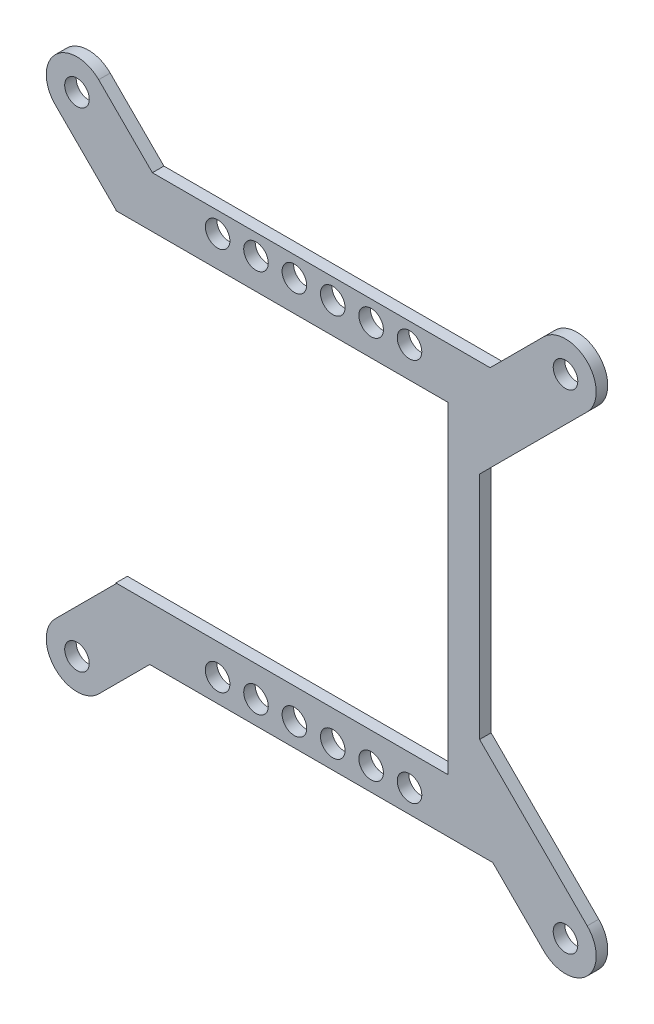
from build123d import *

# Parameters (mm, degrees)
CUT_EXTRUDE1_START       = -1.5
CUT_EXTRUDE1_OUTLINE_R   = 1.6
CUT_EXTRUDE1_DEPTH       = 1.5
CUT_EXTRUDE1_2_OUTLINE_R = 1.6
CUT_EXTRUDE1_2_DEPTH     = 1.5
CUT_EXTRUDE1_3_OUTLINE_R = 1.6
CUT_EXTRUDE1_3_DEPTH     = 1.5
BOSS_EXTRUDE1_DEPTH      = 1.5
BOSS_EXTRUDE2_DEPTH      = 1.5
BOSS_EXTRUDE3_START      = -1.5
SKETCH4_W                = 8
SKETCH4_H                = 34
SKETCH4_R                = 1.6
BOSS_EXTRUDE3_DEPTH      = 1.5
CUT_EXTRUDE2_DEPTH       = 10
SKETCH6_R                = 1.6
CUT_EXTRUDE3_DEPTH       = 10
CUT_EXTRUDE4_DEPTH       = 10
SKETCH8_R                = 1.6
CUT_EXTRUDE6_DEPTH       = 10
BOSS_EXTRUDE4_DEPTH      = 1.5
SKETCH10_W               = 3.5
SKETCH10_H               = 42
CUT_EXTRUDE7_DEPTH       = 10
CUT_EXTRUDE8_START       = -10
SKETCH11_R               = 1.6
CUT_EXTRUDE8_DEPTH       = 10
BOSS_EXTRUDE5_DEPTH      = 1.5
SKETCH13_R               = 1.6
BOSS_EXTRUDE6_DEPTH      = 1.5
SKETCH14_R               = 1.6
CUT_EXTRUDE9_DEPTH       = 10
BOSS_EXTRUDE7_DEPTH      = 1.5
SKETCH16_R               = 1.6
CUT_EXTRUDE10_DEPTH      = 10
SKETCH17_R               = 1.6
BOSS_EXTRUDE8_DEPTH      = 1.5
SKETCH18_R               = 1.6
CUT_EXTRUDE11_DEPTH      = 10
CUT_EXTRUDE12_START      = -2
CUT_EXTRUDE12_OUTLINE_R  = 1.6
CUT_EXTRUDE12_DEPTH      = 3
SKETCH20_R               = 1.6
BOSS_EXTRUDE9_DEPTH      = 1.5
SKETCH21_R               = 1.6
BOSS_EXTRUDE10_DEPTH     = 1.5
SKETCH22_R               = 89.618816207
CUT_EXTRUDE13_DEPTH      = 10


with BuildPart() as part:
    # Cut-Extrude1: read off the stored shape, not the designer's step
    # Cut-Extrude1 outline → Cut-Extrude1 (new body)
    with BuildSketch(Plane.XY.offset(1.5).offset(CUT_EXTRUDE1_START)):
        with BuildLine():
            ThreePointArc((-32.828427125, -27.171572875), (-32.828427125, -32.828427125), (-27.171572875, -32.828427125))
            Line((-27.171572875, -32.828427125), (-15.343145751, -21))
            Line((-15.343145751, -21), (-28, -21))
            Line((-28, -21), (-28, -22.246575342))
            Line((-28, -22.246575342), (-32.876712329, -27.123287671))
            Line((-32.876712329, -27.123287671), (-32.828427125, -27.171572875))
        make_face()
        with Locations((-30, -30)):
            Circle(CUT_EXTRUDE1_OUTLINE_R, mode=Mode.SUBTRACT)
    extrude(amount=CUT_EXTRUDE1_DEPTH)



with BuildPart() as body_2:
    # Cut-Extrude1 2 outline → Cut-Extrude1 2 (new body)
    with BuildSketch(Plane.XY.offset(1.5).offset(CUT_EXTRUDE1_START)):
        with BuildLine():
            Line((21, 31.740068927), (21, -13))
            Line((21, -13), (13, -13))
            Line((13, -13), (13, -20))
            Line((13, -20), (14.343145751, -20))
            Line((14.343145751, -20), (27.171572875, -32.828427125))
            ThreePointArc((27.171572875, -32.828427125), (32.828427125, -32.828427125), (32.828427125, -27.171572875))
            Line((32.828427125, -27.171572875), (28, -22.343145751))
            Line((28, -22.343145751), (28, 27.653870467))
            Line((28, 27.653870467), (36.085493114, 37.454468181))
            ThreePointArc((36.085493114, 37.454468181), (35.545531819, 43.085493114), (29.914506886, 42.545531819))
            Line((29.914506886, 42.545531819), (21, 31.740068927))
        make_face()
        with Locations((30, -30)):
            Circle(CUT_EXTRUDE1_2_OUTLINE_R, mode=Mode.SUBTRACT)
        with Locations((25, -6.5)):
            Circle(CUT_EXTRUDE1_2_OUTLINE_R, mode=Mode.SUBTRACT)
        with Locations((25, -1.5)):
            Circle(CUT_EXTRUDE1_2_OUTLINE_R, mode=Mode.SUBTRACT)
        with Locations((25, 3.5)):
            Circle(CUT_EXTRUDE1_2_OUTLINE_R, mode=Mode.SUBTRACT)
        with Locations((25, 8.5)):
            Circle(CUT_EXTRUDE1_2_OUTLINE_R, mode=Mode.SUBTRACT)
        with Locations((25, 13.5)):
            Circle(CUT_EXTRUDE1_2_OUTLINE_R, mode=Mode.SUBTRACT)
        with Locations((33, 40)):
            Circle(CUT_EXTRUDE1_2_OUTLINE_R, mode=Mode.SUBTRACT)
    extrude(amount=CUT_EXTRUDE1_2_DEPTH)



with BuildPart() as body_3:
    # Cut-Extrude1 3 outline → Cut-Extrude1 3 (new body)
    with BuildSketch(Plane.XY.offset(1.5).offset(CUT_EXTRUDE1_START)):
        with BuildLine():
            Line((-28, 21), (-21, 21))
            Line((-21, 21), (-21, 31.740068927))
            Line((-21, 31.740068927), (-29.914506886, 42.545531819))
            ThreePointArc((-29.914506886, 42.545531819), (-35.545531819, 43.085493114), (-36.085493114, 37.454468181))
            Line((-36.085493114, 37.454468181), (-28, 27.653870467))
            Line((-28, 27.653870467), (-28, 21))
        make_face()
        with Locations((-33, 40)):
            Circle(CUT_EXTRUDE1_3_OUTLINE_R, mode=Mode.SUBTRACT)
    extrude(amount=CUT_EXTRUDE1_3_DEPTH)


with BuildPart() as body_2_1:
    add(body_2.part)

    add(body_3.part)  # Boss-Extrude1 merges body 3
    # Sketch2 → Boss-Extrude1 (add)
    with BuildSketch(Plane.XY.offset(1.5)):
        Polygon((-21, 21), (21, 21), (21, 31.740068927), (17.62888627, 27.653870467), (-17.62888627, 27.653870467), (-21, 31.740068927), align=None)
    extrude(amount=-BOSS_EXTRUDE1_DEPTH)


with BuildPart() as part_1:
    add(part.part)

    add(body_2_1.part)  # Boss-Extrude2 merges body 2
    # Sketch3 → Boss-Extrude2 (add)
    with BuildSketch(Plane.XY.offset(1.5)):
        Polygon((-15.343145751, -21), (-22.343145751, -28), (22.343145751, -28), (15.343145751, -21), align=None)
    extrude(amount=-BOSS_EXTRUDE2_DEPTH)

    # Sketch4 → Boss-Extrude3 (add)
    with BuildSketch(Plane.XY.offset(1.5).offset(BOSS_EXTRUDE3_START)):
        Polygon((14.343145751, -20), (13, -20), (13, -21), (15.343145751, -21), align=None)
        with Locations((17, 4)):
            Rectangle(SKETCH4_W, SKETCH4_H)
        with Locations((25, -6.5)):
            Circle(SKETCH4_R)
        with Locations((25, -1.5)):
            Circle(SKETCH4_R)
        with Locations((25, 3.5)):
            Circle(SKETCH4_R)
        with Locations((25, 8.5)):
            Circle(SKETCH4_R)
        with Locations((25, 13.5)):
            Circle(SKETCH4_R)
    extrude(amount=BOSS_EXTRUDE3_DEPTH)

    # Sketch5 → Cut-Extrude2 (cut)
    with BuildSketch(Plane.XY.offset(1.5)):
        Polygon((28, 27.653870467), (17.62888627, 15.082823521), (17.62888627, -11.972032021), (28, -22.343145751), align=None)
    extrude(amount=-CUT_EXTRUDE2_DEPTH, mode=Mode.SUBTRACT)

    # Sketch6 → Cut-Extrude3 (cut)
    with BuildSketch(Plane.XY.offset(1.5)):
        with Locations((6.5, 25)):
            Circle(SKETCH6_R)
        with Locations((1.5, 25)):
            Circle(SKETCH6_R)
        with Locations((-3.5, 25)):
            Circle(SKETCH6_R)
        with Locations((-8.5, 25)):
            Circle(SKETCH6_R)
        with Locations((-13.5, 25)):
            Circle(SKETCH6_R)
        with Locations((-13.5, -25)):
            Circle(SKETCH6_R)
        with Locations((-8.5, -25)):
            Circle(SKETCH6_R)
        with Locations((-3.5, -25)):
            Circle(SKETCH6_R)
        with Locations((1.5, -25)):
            Circle(SKETCH6_R)
        with Locations((6.5, -25)):
            Circle(SKETCH6_R)
    extrude(amount=-CUT_EXTRUDE3_DEPTH, mode=Mode.SUBTRACT)

    # Sketch7 → Cut-Extrude4 (cut)
    with BuildSketch(Plane.XY.offset(1.5)):
        Polygon((-28, 27.653870467), (-19.973613934, 17.924917659), (-36.717571938, 15.874580857), align=None)
        Polygon((-28, -22.246575342), (-20.930672911, -15.177248254), (-29.189636074, -18.711911798), align=None)
    extrude(amount=-CUT_EXTRUDE4_DEPTH, mode=Mode.SUBTRACT)

    # Sketch8 → Cut-Extrude6 (cut)
    with BuildSketch(Plane.XY.offset(1.5)):
        with Locations((11.5, -25)):
            Circle(SKETCH8_R)
        with Locations((11.5, 25)):
            Circle(SKETCH8_R)
    extrude(amount=-CUT_EXTRUDE6_DEPTH, mode=Mode.SUBTRACT)

    # Sketch9 → Boss-Extrude4 (add)
    with BuildSketch(Plane.XY.offset(1.5)):
        Polygon((20.62888627, 1.55539575), (20.62888627, 18.719187158), (17.62888627, 15.082823521), (17.62888627, -11.972032021), (20.62888627, -14.972032021), align=None)
    extrude(amount=-BOSS_EXTRUDE4_DEPTH)

    # Sketch10 → Cut-Extrude7 (cut)
    with BuildSketch(Plane.XY.offset(1.5)):
        with Locations((14.75, 0)):
            Rectangle(SKETCH10_W, SKETCH10_H)
    extrude(amount=-CUT_EXTRUDE7_DEPTH, mode=Mode.SUBTRACT)

    # Sketch11 → Cut-Extrude8 (cut)
    # profile 1 of 4: a face of its own
    with BuildSketch(Plane.XY.offset(1.5).offset(CUT_EXTRUDE8_START)):
        with BuildLine():
            Line((20.62888627, 27.653870467), (20.62888627, 18.719187158))
            Line((20.62888627, 18.719187158), (36.085493114, 37.454468181))
            ThreePointArc((36.085493114, 37.454468181), (35.545531819, 43.085493114), (29.914506886, 42.545531819))
            Line((29.914506886, 42.545531819), (17.62888627, 27.653870467))
            Line((17.62888627, 27.653870467), (20.62888627, 27.653870467))
        make_face()
        with Locations((33, 40)):
            Circle(SKETCH11_R, mode=Mode.SUBTRACT)
    # profile 2 of 4: a face of its own
    with BuildSketch(Plane.XY.offset(1.5).offset(CUT_EXTRUDE8_START)):
        with BuildLine():
            Line((-36.085493114, 37.454468181), (-26.753424658, 26.142870052))
            Line((-26.753424658, 26.142870052), (-26.753424658, 27.653870467))
            Line((-26.753424658, 27.653870467), (-17.62888627, 27.653870467))
            Line((-17.62888627, 27.653870467), (-29.914506886, 42.545531819))
            ThreePointArc((-29.914506886, 42.545531819), (-35.545531819, 43.085493114), (-36.085493114, 37.454468181))
        make_face()
        with Locations((-33, 40)):
            Circle(SKETCH11_R, mode=Mode.SUBTRACT)
    # profile 3 of 4: a face of its own
    with BuildSketch(Plane.XY.offset(1.5).offset(CUT_EXTRUDE8_START)):
        with BuildLine():
            Line((-27.171572875, -32.828427125), (-22.343145751, -28))
            Line((-22.343145751, -28), (-26.753424658, -28))
            Line((-26.753424658, -28), (-26.753424658, -21))
            Line((-26.753424658, -21), (-32.876712329, -27.123287671))
            Line((-32.876712329, -27.123287671), (-32.828427125, -27.171572875))
            ThreePointArc((-32.828427125, -27.171572875), (-32.828427125, -32.828427125), (-27.171572875, -32.828427125))
        make_face()
        with Locations((-30, -30)):
            Circle(SKETCH11_R, mode=Mode.SUBTRACT)
    # profile 4 of 4: a face of its own
    with BuildSketch(Plane.XY.offset(1.5).offset(CUT_EXTRUDE8_START)):
        with BuildLine():
            Line((32.828427125, -27.171572875), (20.62888627, -14.972032021))
            Line((20.62888627, -14.972032021), (20.62888627, -28))
            Line((20.62888627, -28), (22.343145751, -28))
            Line((22.343145751, -28), (27.171572875, -32.828427125))
            ThreePointArc((27.171572875, -32.828427125), (32.828427125, -32.828427125), (32.828427125, -27.171572875))
        make_face()
        with Locations((30, -30)):
            Circle(SKETCH11_R, mode=Mode.SUBTRACT)
    extrude(amount=CUT_EXTRUDE8_DEPTH, mode=Mode.SUBTRACT)

    # Sketch12 → Boss-Extrude5 (add)
    with BuildSketch(Plane.XY.offset(1.5)):
        Polygon((-22.510556865, 21), (-26.753424658, 21), (-26.753424658, 26.142870052), align=None)
    extrude(amount=-BOSS_EXTRUDE5_DEPTH)

    # Sketch13 → Boss-Extrude6 (add)
    # profile 1 of 4: a face of its own
    with BuildSketch(Plane.XY.offset(1.5)):
        with BuildLine():
            Line((20.62888627, 26.28574052), (20.62888627, 14.972032021))
            Line((20.62888627, 14.972032021), (46.669047558, 41.012193309))
            ThreePointArc((46.669047558, 41.012193309), (46.669047558, 46.669047558), (41.012193309, 46.669047558))
            Line((41.012193309, 46.669047558), (20.62888627, 26.28574052))
        make_face()
    # profile 2 of 4: a face of its own
    with BuildSketch(Plane.XY.offset(1.5)):
        with BuildLine():
            Line((-46.669047558, 41.012193309), (-26.753424658, 21.096570408))
            Line((-26.753424658, 21.096570408), (-26.753424658, 27.653870467))
            Line((-26.753424658, 27.653870467), (-21.997016217, 27.653870467))
            Line((-21.997016217, 27.653870467), (-41.012193309, 46.669047558))
            ThreePointArc((-41.012193309, 46.669047558), (-46.669047558, 46.669047558), (-46.669047558, 41.012193309))
        make_face()
        with Locations((-43.840620434, 43.840620434)):
            Circle(SKETCH13_R, mode=Mode.SUBTRACT)
    # profile 3 of 4: a face of its own
    with BuildSketch(Plane.XY.offset(1.5)):
        with BuildLine():
            ThreePointArc((-46.669047558, -41.012193309), (-46.669047558, -46.669047558), (-41.012193309, -46.669047558))
            Line((-41.012193309, -46.669047558), (-22.343145751, -28))
            Line((-22.343145751, -28), (-26.753424658, -28))
            Line((-26.753424658, -28), (-26.753424658, -21.096570408))
            Line((-26.753424658, -21.096570408), (-46.669047558, -41.012193309))
        make_face()
        with Locations((-43.840620434, -43.840620434)):
            Circle(SKETCH13_R, mode=Mode.SUBTRACT)
    # profile 4 of 4: a face of its own
    with BuildSketch(Plane.XY.offset(1.5)):
        with BuildLine():
            Line((20.62888627, -26.28574052), (41.012193309, -46.669047558))
            ThreePointArc((41.012193309, -46.669047558), (46.669047558, -46.669047558), (46.669047558, -41.012193309))
            Line((46.669047558, -41.012193309), (20.62888627, -14.972032021))
            Line((20.62888627, -14.972032021), (20.62888627, -26.28574052))
        make_face()
        with Locations((43.840620434, -43.840620434)):
            Circle(SKETCH13_R, mode=Mode.SUBTRACT)
    extrude(amount=-BOSS_EXTRUDE6_DEPTH)

    # Sketch14 → Cut-Extrude9 (cut)
    with BuildSketch(Plane.XY.offset(1.5)):
        with Locations((43.840620434, 43.840620434)):
            Circle(SKETCH14_R)
    extrude(amount=-CUT_EXTRUDE9_DEPTH, mode=Mode.SUBTRACT)

    # Sketch15 → Boss-Extrude7 (add)
    with BuildSketch(Plane.XY.offset(1.5)):
        Polygon((20.62888627, -28), (22.343145751, -28), (22.343145751, -20.852318202), (17.520154223, -24.044979555), align=None)
        Polygon((20.62888627, 27.653870467), (24.477160925, 27.653870467), (19.074520247, 22.251229789), (17.520154223, 26.392880602), align=None)
    extrude(amount=-BOSS_EXTRUDE7_DEPTH)

    # Sketch16 → Cut-Extrude10 (cut)
    with BuildSketch(Plane.XY.offset(1.5)):
        with Locations((-31.819805153, 31.819805153)):
            Circle(SKETCH16_R)
        with Locations((31.819805153, 31.819805153)):
            Circle(SKETCH16_R)
        with Locations((31.819805153, -31.819805153)):
            Circle(SKETCH16_R)
        with Locations((-31.819805153, -31.819805153)):
            Circle(SKETCH16_R)
    extrude(amount=-CUT_EXTRUDE10_DEPTH, mode=Mode.SUBTRACT)

    # Sketch17 → Boss-Extrude8 (add)
    with BuildSketch(Plane.XY.offset(1.5)):
        with BuildLine():
            ThreePointArc((-31.819805153, 35.819805153), (-28.355703538, 33.819805153), (-28.355703538, 29.819805153))
            Line((-28.355703538, 29.819805153), (28.355703538, 29.819805153))
            ThreePointArc((28.355703538, 29.819805153), (28.355703538, 33.819805153), (31.819805153, 35.819805153))
            Line((31.819805153, 35.819805153), (-31.819805153, 35.819805153))
        make_face()
        with Locations((-8, 32.819805153)):
            Circle(SKETCH17_R, mode=Mode.SUBTRACT)
        with Locations((8, 32.819805153)):
            Circle(SKETCH17_R, mode=Mode.SUBTRACT)
    extrude(amount=-BOSS_EXTRUDE8_DEPTH)

    # Sketch18 → Cut-Extrude11 (cut)
    with BuildSketch(Plane.XY.offset(1.5)):
        with Locations((38.890872965, -38.890872965)):
            Circle(SKETCH18_R)
        with Locations((-38.890872965, -38.890872965)):
            Circle(SKETCH18_R)
        with Locations((38.890872965, 38.890872965)):
            Circle(SKETCH18_R)
        with Locations((-38.890872965, 38.890872965)):
            Circle(SKETCH18_R)
    extrude(amount=-CUT_EXTRUDE11_DEPTH, mode=Mode.SUBTRACT)

    # Cut-Extrude12: read off the stored shape, not the designer's step
    # Cut-Extrude12 outline → Cut-Extrude12 (cut)
    # profile 1 of 4: a face of its own
    with BuildSketch(Plane.XY.offset(1.5).offset(CUT_EXTRUDE12_START)):
        with BuildLine():
            Line((36.222978367, 41.879832617), (36.224492351, 41.872552763))
            ThreePointArc((36.224492351, 41.872552763), (41.797056095, 41.639345199), (41.71930009, 36.062445841))
            Line((41.71930009, 36.062445841), (46.669047558, 41.012193309))
            ThreePointArc((46.669047558, 41.012193309), (46.669047558, 46.669047558), (41.012193309, 46.669047558))
            Line((41.012193309, 46.669047558), (36.222978367, 41.879832617))
        make_face()
        with Locations((43.840620434, 43.840620434)):
            Circle(CUT_EXTRUDE12_OUTLINE_R, mode=Mode.SUBTRACT)
    # profile 2 of 4: a face of its own
    with BuildSketch(Plane.XY.offset(1.5).offset(CUT_EXTRUDE12_START)):
        with BuildLine():
            ThreePointArc((41.71930009, -36.062445841), (41.71930009, -41.71930009), (36.062445841, -41.71930009))
            Line((36.062445841, -41.71930009), (41.012193309, -46.669047558))
            ThreePointArc((41.012193309, -46.669047558), (46.669047558, -46.669047558), (46.669047558, -41.012193309))
            Line((46.669047558, -41.012193309), (41.71930009, -36.062445841))
        make_face()
        with Locations((43.840620434, -43.840620434)):
            Circle(CUT_EXTRUDE12_OUTLINE_R, mode=Mode.SUBTRACT)
    # profile 3 of 4: a face of its own
    with BuildSketch(Plane.XY.offset(1.5).offset(CUT_EXTRUDE12_START)):
        with BuildLine():
            ThreePointArc((-36.062445841, -41.71930009), (-41.550778866, -41.878330178), (-42.027335486, -36.408413931))
            Line((-42.027335486, -36.408413931), (-42.048509384, -36.391655135))
            Line((-42.048509384, -36.391655135), (-46.669047558, -41.012193309))
            ThreePointArc((-46.669047558, -41.012193309), (-46.669047558, -46.669047558), (-41.012193309, -46.669047558))
            Line((-41.012193309, -46.669047558), (-36.062445841, -41.71930009))
        make_face()
        with Locations((-43.840620434, -43.840620434)):
            Circle(CUT_EXTRUDE12_OUTLINE_R, mode=Mode.SUBTRACT)
    # profile 4 of 4: a face of its own
    with BuildSketch(Plane.XY.offset(1.5).offset(CUT_EXTRUDE12_START)):
        with BuildLine():
            ThreePointArc((-41.815610055, 36.162152944), (-41.66986379, 41.767887042), (-36.062445841, 41.71930009))
            Line((-36.062445841, 41.71930009), (-41.012193309, 46.669047558))
            ThreePointArc((-41.012193309, 46.669047558), (-46.669047558, 46.669047558), (-46.669047558, 41.012193309))
            Line((-46.669047558, 41.012193309), (-41.817773996, 36.160919747))
            Line((-41.817773996, 36.160919747), (-41.815610055, 36.162152944))
        make_face()
        with Locations((-43.840620434, 43.840620434)):
            Circle(CUT_EXTRUDE12_OUTLINE_R, mode=Mode.SUBTRACT)
    extrude(amount=CUT_EXTRUDE12_DEPTH, mode=Mode.SUBTRACT)

    # Sketch20 → Boss-Extrude9 (add)
    # profile 1 of 2: a face of its own
    with BuildSketch(Plane.XY.offset(1.5)):
        Polygon((-30.162950904, 35.819805153), (-24.162950904, 29.819805153), (24.162950904, 29.819805153), (30.162950904, 35.819805153), align=None)
        with Locations((-8, 32.819805153)):
            Circle(SKETCH20_R, mode=Mode.SUBTRACT)
        with Locations((8, 32.819805153)):
            Circle(SKETCH20_R, mode=Mode.SUBTRACT)
    # profile 2 of 2: a face of its own
    with BuildSketch(Plane.XY.offset(1.5)):
        Polygon((30.162950904, -35.819805153), (-30.162950904, -35.819805153), (-24.162950904, -29.819805153), (24.162950904, -29.819805153), align=None)
        with Locations((8, -32.819805153)):
            Circle(SKETCH20_R, mode=Mode.SUBTRACT)
        with Locations((-8, -32.819805153)):
            Circle(SKETCH20_R, mode=Mode.SUBTRACT)
    extrude(amount=-BOSS_EXTRUDE9_DEPTH)

    # Sketch21 → Boss-Extrude10 (add)
    with BuildSketch(Plane.XY.offset(1.5)):
        Polygon((24.162950904, 24.506096654), (24.162950904, -29.819805153), (30.162950904, -26.836364226), (30.162950904, 24.506096654), align=None)
        with Locations((27.162950904, 8)):
            Circle(SKETCH21_R, mode=Mode.SUBTRACT)
        with Locations((27.162950904, -8)):
            Circle(SKETCH21_R, mode=Mode.SUBTRACT)
    extrude(amount=-BOSS_EXTRUDE10_DEPTH)

    # Sketch22 → Cut-Extrude13 (cut)
    with BuildSketch(Plane.XY.offset(1.5)):
        Circle(SKETCH22_R)
        with BuildLine():
            Line((-24.162950904, -29.819805153), (-28.991378029, -34.648232278))
            ThreePointArc((-28.991378029, -34.648232278), (-34.648232278, -34.648232278), (-34.648232278, -28.991378029))
            Line((-34.648232278, -28.991378029), (-26.753424658, -21.096570408))
            Line((-26.753424658, -21.096570408), (-26.753424658, -21))
            Line((-26.753424658, -21), (-26.753424658, 21.096570408))
            Line((-26.753424658, 21.096570408), (-34.648232278, 28.991378029))
            ThreePointArc((-34.648232278, 28.991378029), (-34.648232278, 34.648232278), (-28.991378029, 34.648232278))
            Line((-28.991378029, 34.648232278), (-21.997016217, 27.653870467))
            Line((-21.997016217, 27.653870467), (21.997016217, 27.653870467))
            Line((21.997016217, 27.653870467), (28.991378029, 34.648232278))
            ThreePointArc((28.991378029, 34.648232278), (34.648232278, 34.648232278), (34.648232278, 28.991378029))
            Line((34.648232278, 28.991378029), (20.62888627, 14.972032021))
            Line((20.62888627, 14.972032021), (20.62888627, -14.972032021))
            Line((20.62888627, -14.972032021), (34.648232278, -28.991378029))
            ThreePointArc((34.648232278, -28.991378029), (34.648232278, -34.648232278), (28.991378029, -34.648232278))
            Line((28.991378029, -34.648232278), (24.162950904, -29.819805153))
            Line((24.162950904, -29.819805153), (-24.162950904, -29.819805153))
        make_face(mode=Mode.SUBTRACT)
    extrude(amount=-CUT_EXTRUDE13_DEPTH, mode=Mode.SUBTRACT)


solid = part_1.part
